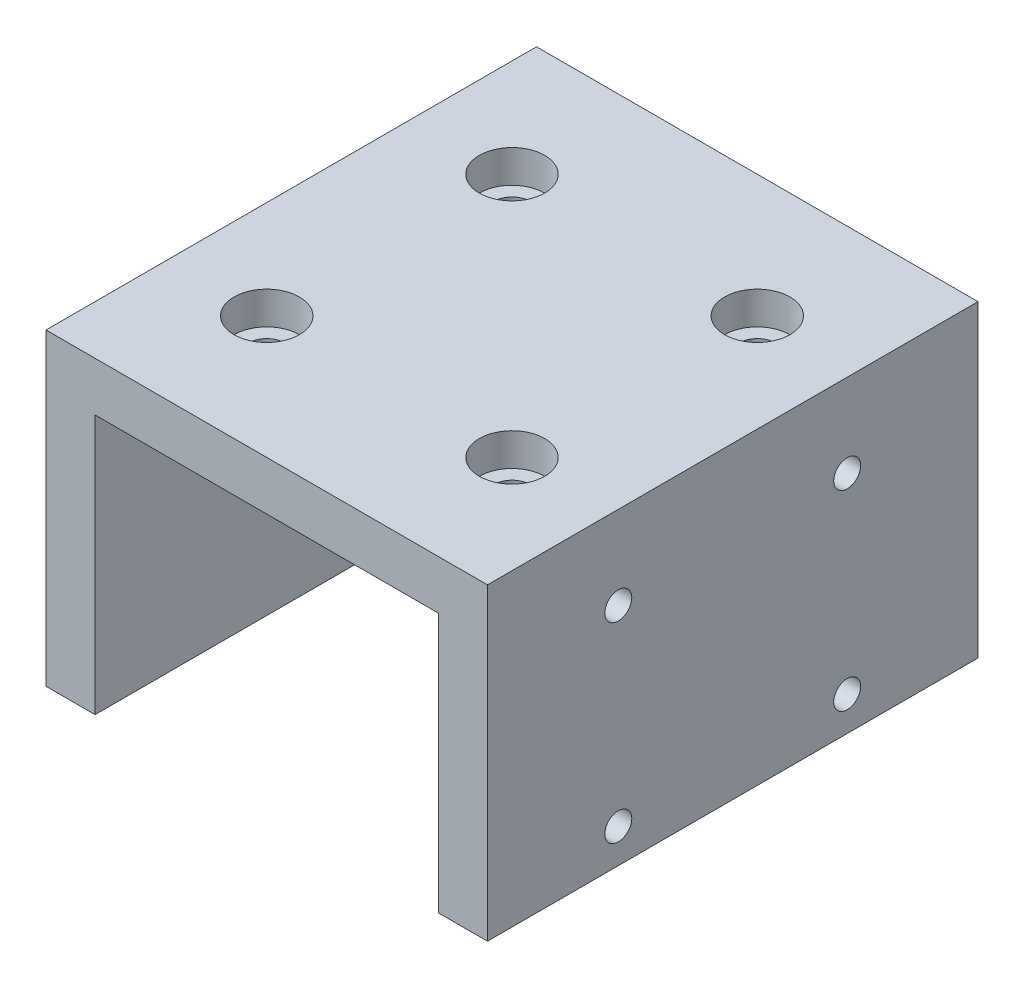
from build123d import *

# Parameters (mm, degrees)
SKETCH1_W                      = 54
SKETCH1_H                      = 37.75
BOSS_EXTRUDE1_DEPTH            = 30
SKETCH2_W                      = 42
SKETCH2_H                      = 31.75
CUT_EXTRUDE1_DEPTH             = 76.855537042
CBORE_FOR_M4_SHCS1_D           = 4.5
CBORE_FOR_M4_SHCS1_DEPTH       = 6
CBORE_FOR_M4_SHCS1_CBORE_D     = 8
CBORE_FOR_M4_SHCS1_CBORE_DEPTH = 4
M5_CLEARANCE_HOLE1_D           = 5.5
M5_CLEARANCE_HOLE1_DEPTH       = 6
CBORE_START                    = 33.75
CBORE_FOR_M4_SHCS2_OUTLINE_R   = 4
CBORE_FOR_M4_SHCS2_DEPTH       = 4
CBORE_START_2                  = 31.75
CBORE_FOR_M4_SHCS2_2_OUTLINE_R = 2.25
CBORE_FOR_M4_SHCS2_2_DEPTH     = 2
M4X0_7_START                   = 21
M4X0_7_TAPPED_HOLE1_OUTLINE_R  = 1.65
M4X0_7_TAPPED_HOLE1_DEPTH      = 6


# Read off the part's stored shape, not the designer's step: CBORE for M4 SHCS2, M4x0.7 Tapped Hole1
with BuildPart() as part:
    # Sketch1 → Boss-Extrude1 (new, symmetric)
    with BuildSketch(Plane.XY):
        with Locations((0, 18.875)):
            Rectangle(SKETCH1_W, SKETCH1_H)
    extrude(amount=BOSS_EXTRUDE1_DEPTH, both=True)

    # Sketch2 → Cut-Extrude1 (cut, through all)
    with BuildSketch(Plane.XY.offset(30)):
        with Locations((0, 15.875)):
            Rectangle(SKETCH2_W, SKETCH2_H)
    extrude(amount=-CUT_EXTRUDE1_DEPTH, mode=Mode.SUBTRACT)

    # CBORE for M4 SHCS1
    with Locations(Plane.ZY.offset(27)):
        with Locations((15, 25.4), (0, 24.25), (0, 7.75), (-15, 25.4)):
            CounterBoreHole(CBORE_FOR_M4_SHCS1_D / 2, CBORE_FOR_M4_SHCS1_CBORE_D / 2, CBORE_FOR_M4_SHCS1_CBORE_DEPTH, depth=CBORE_FOR_M4_SHCS1_DEPTH)

    # M5 Clearance Hole1
    with Locations(Plane.ZY.offset(27)):
        with Locations((-24.5, 23.25), (-24.5, 6.75)):
            Hole(M5_CLEARANCE_HOLE1_D / 2, depth=M5_CLEARANCE_HOLE1_DEPTH)

    # CBORE for M4 SHCS2 outline → CBORE for M4 SHCS2 (cut)
    with BuildSketch(Plane(origin=(0, 0, 0), x_dir=(1, 0, 0), z_dir=(0, 1, 0)).offset(CBORE_START)):
        with Locations((15, 15)):
            Circle(CBORE_FOR_M4_SHCS2_OUTLINE_R)
        with Locations((-15, -15)):
            Circle(CBORE_FOR_M4_SHCS2_OUTLINE_R)
        with Locations((-15, 15)):
            Circle(CBORE_FOR_M4_SHCS2_OUTLINE_R)
        with Locations((15, -15)):
            Circle(CBORE_FOR_M4_SHCS2_OUTLINE_R)
    extrude(amount=CBORE_FOR_M4_SHCS2_DEPTH, mode=Mode.SUBTRACT)

    # CBORE for M4 SHCS2 2 outline → CBORE for M4 SHCS2 2 (cut)
    with BuildSketch(Plane(origin=(0, 0, 0), x_dir=(1, 0, 0), z_dir=(0, 1, 0)).offset(CBORE_START_2)):
        with Locations((15, 15)):
            Circle(CBORE_FOR_M4_SHCS2_2_OUTLINE_R)
        with Locations((-15, -15)):
            Circle(CBORE_FOR_M4_SHCS2_2_OUTLINE_R)
        with Locations((-15, 15)):
            Circle(CBORE_FOR_M4_SHCS2_2_OUTLINE_R)
        with Locations((15, -15)):
            Circle(CBORE_FOR_M4_SHCS2_2_OUTLINE_R)
    extrude(amount=CBORE_FOR_M4_SHCS2_2_DEPTH, mode=Mode.SUBTRACT)

    # M4x0.7 Tapped Hole1 outline → M4x0.7 Tapped Hole1 (cut)
    with BuildSketch(Plane.YZ.offset(M4X0_7_START)):
        with Locations((27.575, 14)):
            Circle(M4X0_7_TAPPED_HOLE1_OUTLINE_R)
        with Locations((4.175, -14)):
            Circle(M4X0_7_TAPPED_HOLE1_OUTLINE_R)
        with Locations((27.575, -14)):
            Circle(M4X0_7_TAPPED_HOLE1_OUTLINE_R)
        with Locations((4.175, 14)):
            Circle(M4X0_7_TAPPED_HOLE1_OUTLINE_R)
    extrude(amount=M4X0_7_TAPPED_HOLE1_DEPTH, mode=Mode.SUBTRACT)


solid = part.part
